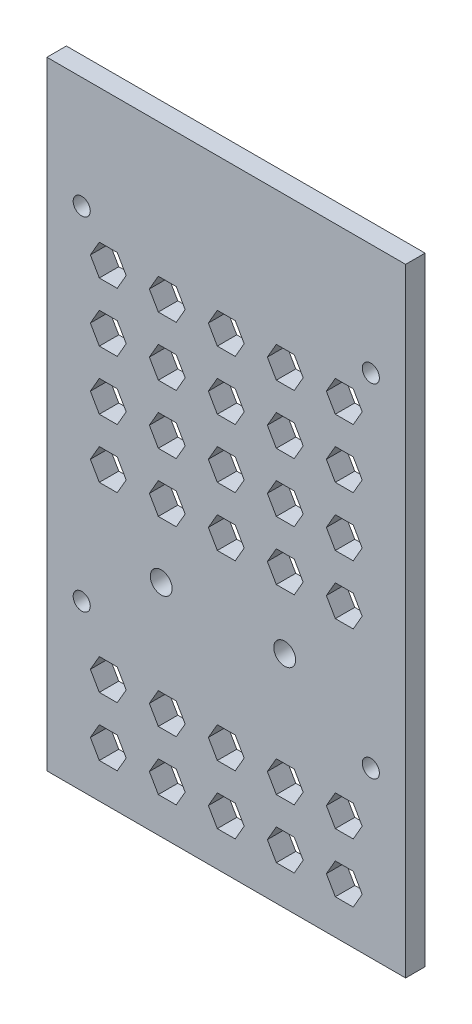
from build123d import *

# Parameters (mm, degrees)
EXTRUDE_1_OUTLINE_W   = 60.8
EXTRUDE_1_OUTLINE_H   = 88.755814015
EXTRUDE_1_OUTLINE_R   = 1.45
EXTRUDE_1_OUTLINE_R_2 = 1.85
EXTRUDE_1_DEPTH       = 3.3
SKETCH_2_W            = 60.8
SKETCH_2_H            = 3.3
EXTRUDE_2_DEPTH       = 16


# Read off the part's stored shape, not the designer's step: 填料-伸長1
with BuildPart() as part:
    # 填料-伸長1 outline → 填料-伸長1 (new body)
    with BuildSketch(Plane.XY):
        with Locations((1.326158038, -1.737600889)):
            Rectangle(EXTRUDE_1_OUTLINE_W, EXTRUDE_1_OUTLINE_H)
        Polygon((-15.638485556, -37.518581742), (-17.156163759, -40.147277499), (-20.191520165, -40.147277499), (-21.709198368, -37.518581742), (-20.191520165, -34.889885985), (-17.156163759, -34.889885985), align=None, mode=Mode.SUBTRACT)
        Polygon((-15.638485556, -27.518581742), (-17.156163759, -30.147277499), (-20.191520165, -30.147277499), (-21.709198368, -27.518581742), (-20.191520165, -24.889885985), (-17.156163759, -24.889885985), align=None, mode=Mode.SUBTRACT)
        Polygon((-5.638485556, -37.518581742), (-7.156163759, -40.147277499), (-10.191520165, -40.147277499), (-11.709198368, -37.518581742), (-10.191520165, -34.889885985), (-7.156163759, -34.889885985), align=None, mode=Mode.SUBTRACT)
        Polygon((4.361514444, -37.518581742), (2.843836241, -40.147277499), (-0.191520165, -40.147277499), (-1.709198368, -37.518581742), (-0.191520165, -34.889885985), (2.843836241, -34.889885985), align=None, mode=Mode.SUBTRACT)
        Polygon((-5.638485556, -27.518581742), (-7.156163759, -30.147277499), (-10.191520165, -30.147277499), (-11.709198368, -27.518581742), (-10.191520165, -24.889885985), (-7.156163759, -24.889885985), align=None, mode=Mode.SUBTRACT)
        Polygon((4.361514444, -27.518581742), (2.843836241, -30.147277499), (-0.191520165, -30.147277499), (-1.709198368, -27.518581742), (-0.191520165, -24.889885985), (2.843836241, -24.889885985), align=None, mode=Mode.SUBTRACT)
        with Locations((-23.173841962, -18.259693882)):
            Circle(EXTRUDE_1_OUTLINE_R, mode=Mode.SUBTRACT)
        with Locations((-9.7, -8.761035422)):
            Circle(EXTRUDE_1_OUTLINE_R_2, mode=Mode.SUBTRACT)
        Polygon((14.361514444, -37.518581742), (12.843836241, -40.147277499), (9.808479835, -40.147277499), (8.290801632, -37.518581742), (9.808479835, -34.889885985), (12.843836241, -34.889885985), align=None, mode=Mode.SUBTRACT)
        Polygon((14.361514444, -27.518581742), (12.843836241, -30.147277499), (9.808479835, -30.147277499), (8.290801632, -27.518581742), (9.808479835, -24.889885985), (12.843836241, -24.889885985), align=None, mode=Mode.SUBTRACT)
        Polygon((24.361514444, -37.518581742), (22.843836241, -40.147277499), (19.808479835, -40.147277499), (18.290801632, -37.518581742), (19.808479835, -34.889885985), (22.843836241, -34.889885985), align=None, mode=Mode.SUBTRACT)
        Polygon((24.361514444, -27.518581742), (22.843836241, -30.147277499), (19.808479835, -30.147277499), (18.290801632, -27.518581742), (19.808479835, -24.889885985), (22.843836241, -24.889885985), align=None, mode=Mode.SUBTRACT)
        with Locations((11.226158038, -8.761035422)):
            Circle(EXTRUDE_1_OUTLINE_R_2, mode=Mode.SUBTRACT)
        with Locations((25.826158038, -18.259693882)):
            Circle(EXTRUDE_1_OUTLINE_R, mode=Mode.SUBTRACT)
        Polygon((-15.638485556, 3.308390173), (-17.156163759, 0.679694416), (-20.191520165, 0.679694416), (-21.709198368, 3.308390173), (-20.191520165, 5.93708593), (-17.156163759, 5.93708593), align=None, mode=Mode.SUBTRACT)
        Polygon((-15.638485556, 13.308390173), (-17.156163759, 10.679694416), (-20.191520165, 10.679694416), (-21.709198368, 13.308390173), (-20.191520165, 15.93708593), (-17.156163759, 15.93708593), align=None, mode=Mode.SUBTRACT)
        Polygon((-5.638485556, 3.308390173), (-7.156163759, 0.679694416), (-10.191520165, 0.679694416), (-11.709198368, 3.308390173), (-10.191520165, 5.93708593), (-7.156163759, 5.93708593), align=None, mode=Mode.SUBTRACT)
        Polygon((4.361514444, 3.308390173), (2.843836241, 0.679694416), (-0.191520165, 0.679694416), (-1.709198368, 3.308390173), (-0.191520165, 5.93708593), (2.843836241, 5.93708593), align=None, mode=Mode.SUBTRACT)
        Polygon((-5.638485556, 13.308390173), (-7.156163759, 10.679694416), (-10.191520165, 10.679694416), (-11.709198368, 13.308390173), (-10.191520165, 15.93708593), (-7.156163759, 15.93708593), align=None, mode=Mode.SUBTRACT)
        Polygon((4.361514444, 13.308390173), (2.843836241, 10.679694416), (-0.191520165, 10.679694416), (-1.709198368, 13.308390173), (-0.191520165, 15.93708593), (2.843836241, 15.93708593), align=None, mode=Mode.SUBTRACT)
        Polygon((-15.638485556, 23.308390173), (-17.156163759, 20.679694416), (-20.191520165, 20.679694416), (-21.709198368, 23.308390173), (-20.191520165, 25.93708593), (-17.156163759, 25.93708593), align=None, mode=Mode.SUBTRACT)
        with Locations((-23.173841962, 39.740306118)):
            Circle(EXTRUDE_1_OUTLINE_R, mode=Mode.SUBTRACT)
        Polygon((-15.638485556, 33.308390173), (-17.156163759, 30.679694416), (-20.191520165, 30.679694416), (-21.709198368, 33.308390173), (-20.191520165, 35.93708593), (-17.156163759, 35.93708593), align=None, mode=Mode.SUBTRACT)
        Polygon((-5.638485556, 23.308390173), (-7.156163759, 20.679694416), (-10.191520165, 20.679694416), (-11.709198368, 23.308390173), (-10.191520165, 25.93708593), (-7.156163759, 25.93708593), align=None, mode=Mode.SUBTRACT)
        Polygon((4.361514444, 23.308390173), (2.843836241, 20.679694416), (-0.191520165, 20.679694416), (-1.709198368, 23.308390173), (-0.191520165, 25.93708593), (2.843836241, 25.93708593), align=None, mode=Mode.SUBTRACT)
        Polygon((-5.638485556, 33.308390173), (-7.156163759, 30.679694416), (-10.191520165, 30.679694416), (-11.709198368, 33.308390173), (-10.191520165, 35.93708593), (-7.156163759, 35.93708593), align=None, mode=Mode.SUBTRACT)
        Polygon((4.361514444, 33.308390173), (2.843836241, 30.679694416), (-0.191520165, 30.679694416), (-1.709198368, 33.308390173), (-0.191520165, 35.93708593), (2.843836241, 35.93708593), align=None, mode=Mode.SUBTRACT)
        Polygon((14.361514444, 3.308390173), (12.843836241, 0.679694416), (9.808479835, 0.679694416), (8.290801632, 3.308390173), (9.808479835, 5.93708593), (12.843836241, 5.93708593), align=None, mode=Mode.SUBTRACT)
        Polygon((14.361514444, 13.308390173), (12.843836241, 10.679694416), (9.808479835, 10.679694416), (8.290801632, 13.308390173), (9.808479835, 15.93708593), (12.843836241, 15.93708593), align=None, mode=Mode.SUBTRACT)
        Polygon((24.361514444, 3.308390173), (22.843836241, 0.679694416), (19.808479835, 0.679694416), (18.290801632, 3.308390173), (19.808479835, 5.93708593), (22.843836241, 5.93708593), align=None, mode=Mode.SUBTRACT)
        Polygon((24.361514444, 13.308390173), (22.843836241, 10.679694416), (19.808479835, 10.679694416), (18.290801632, 13.308390173), (19.808479835, 15.93708593), (22.843836241, 15.93708593), align=None, mode=Mode.SUBTRACT)
        Polygon((14.361514444, 23.308390173), (12.843836241, 20.679694416), (9.808479835, 20.679694416), (8.290801632, 23.308390173), (9.808479835, 25.93708593), (12.843836241, 25.93708593), align=None, mode=Mode.SUBTRACT)
        Polygon((14.361514444, 33.308390173), (12.843836241, 30.679694416), (9.808479835, 30.679694416), (8.290801632, 33.308390173), (9.808479835, 35.93708593), (12.843836241, 35.93708593), align=None, mode=Mode.SUBTRACT)
        Polygon((24.361514444, 23.308390173), (22.843836241, 20.679694416), (19.808479835, 20.679694416), (18.290801632, 23.308390173), (19.808479835, 25.93708593), (22.843836241, 25.93708593), align=None, mode=Mode.SUBTRACT)
        Polygon((24.361514444, 33.308390173), (22.843836241, 30.679694416), (19.808479835, 30.679694416), (18.290801632, 33.308390173), (19.808479835, 35.93708593), (22.843836241, 35.93708593), align=None, mode=Mode.SUBTRACT)
        with Locations((25.826158038, 39.740306118)):
            Circle(EXTRUDE_1_OUTLINE_R, mode=Mode.SUBTRACT)
    extrude(amount=EXTRUDE_1_DEPTH)

    # 草圖2 → 填料-伸長2 (add)
    with BuildSketch(Plane(origin=(0, 42.640306118, 0), x_dir=(1, 0, 0), z_dir=(0, 1, 0))):
        with Locations((1.326158038, -1.65)):
            Rectangle(SKETCH_2_W, SKETCH_2_H)
    extrude(amount=EXTRUDE_2_DEPTH)


solid = part.part
